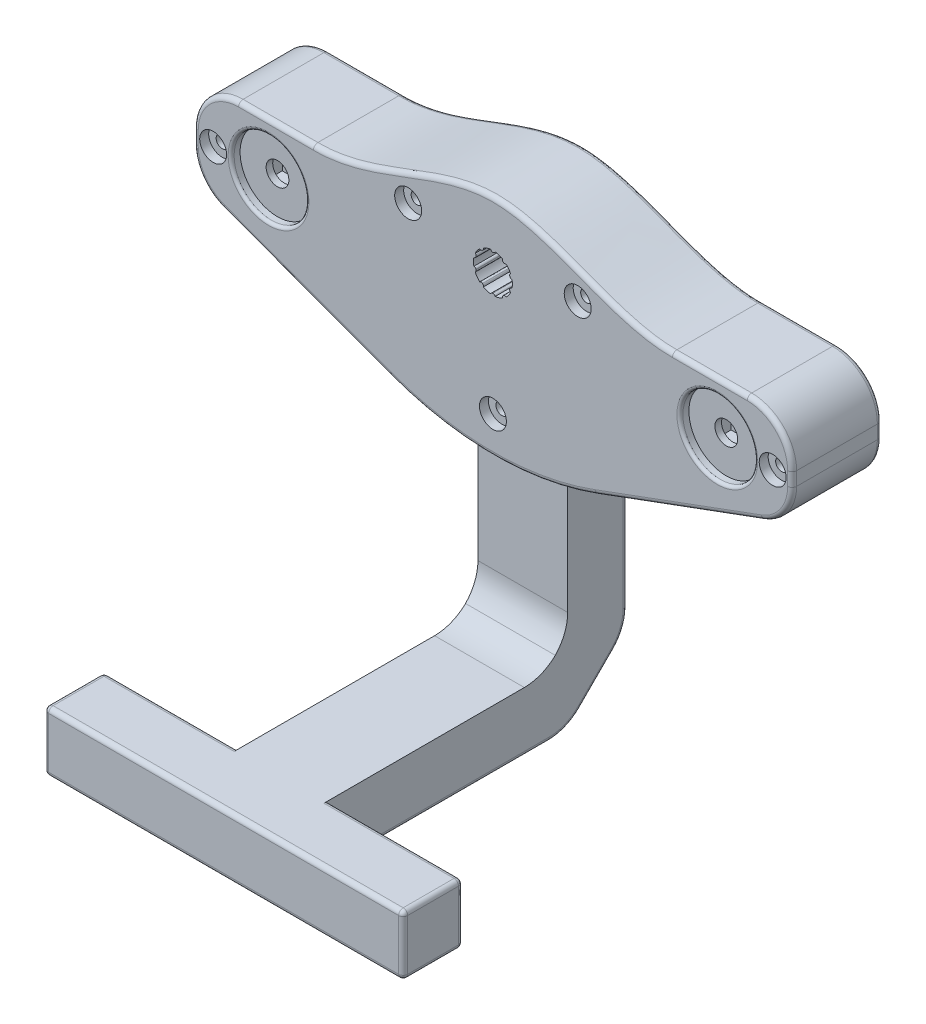
from build123d import *
from OCP.BRepFilletAPI import BRepFilletAPI_MakeChamfer

# Parameters (mm, degrees)
BOSS_EXTRUDE1_DEPTH           = 10
BOSS_EXTRUDE1_DEPTH_BACK      = 20
CUT_EXTRUDE10_START           = -3
SKETCH18_W                    = 25.5
SKETCH18_H                    = 24.1
CUT_EXTRUDE10_DEPTH           = 4.1
SKETCH19_W                    = 8.6
SKETCH19_H                    = 8.6
CUT_EXTRUDE13_DEPTH           = 3.7
CUT_EXTRUDE14_DEPTH           = 2
SKETCH21_R                    = 3.8
CUT_EXTRUDE15_DEPTH           = 116.348128402
SKETCH10_R                    = 12.5
CUT_EXTRUDE8_DEPTH            = 3
SKETCH22_R                    = 0.95
BOSS_EXTRUDE5_DEPTH           = 1.1
BOSS_EXTRUDE5_DRAFT           = 30
BOSS_EXTRUDE5_PROFILE_2_DEPTH = 1.1
BOSS_EXTRUDE5_PROFILE_2_DRAFT = 30
BOSS_EXTRUDE5_PROFILE_3_DEPTH = 1.1
BOSS_EXTRUDE5_PROFILE_3_DRAFT = 30
BOSS_EXTRUDE5_PROFILE_4_DEPTH = 1.1
BOSS_EXTRUDE5_PROFILE_4_DRAFT = 30
CUT_EXTRUDE16_DEPTH           = 8.5
FILLET13_R                    = 2
BOSS_EXTRUDE6_DEPTH           = 3
LPATTERN1_COUNT               = 2
LPATTERN1_PITCH               = 150
LPATTERN1_COPY_1_SKETCH_R     = 0.95
LPATTERN1_COPY_1_DEPTH        = 1.1
LPATTERN1_COPY_1_DRAFT        = 30
LPATTERN1_COPY_2_SKETCH_R     = 0.95
LPATTERN1_COPY_2_DEPTH        = 1.1
LPATTERN1_COPY_2_DRAFT        = 30
LPATTERN1_COPY_3_SKETCH_R     = 0.95
LPATTERN1_COPY_3_DEPTH        = 1.1
LPATTERN1_COPY_3_DRAFT        = 30
LPATTERN1_COPY_4_SKETCH_R     = 0.95
LPATTERN1_COPY_4_DEPTH        = 1.1
LPATTERN1_COPY_4_DRAFT        = 30
LPATTERN1_COPY_5_SKETCH_R     = 0.95
LPATTERN1_COPY_5_DEPTH        = 1.1
LPATTERN1_COPY_5_DRAFT        = 30
LPATTERN1_COPY_6_SKETCH_R     = 0.95
LPATTERN1_COPY_6_DEPTH        = 1.1
LPATTERN1_COPY_6_DRAFT        = 30
LPATTERN1_COPY_7_SKETCH_R     = 0.95
LPATTERN1_COPY_7_DEPTH        = 1.1
LPATTERN1_COPY_7_DRAFT        = 30
FILLET13_OF_LPATTERN1_R       = 2
SKETCH12_R                    = 15
CUT_EXTRUDE9_DEPTH            = 8
SKETCH11_W                    = 30
SKETCH11_H                    = 55.928336779
BOSS_EXTRUDE2_DEPTH           = 20
BOSS_EXTRUDE3_DEPTH           = 15
SKETCH17_W                    = 120
SKETCH17_H                    = 20
BOSS_EXTRUDE4_DEPTH           = 20
CHAMFER1_SIZE                 = 1.5
CHAMFER1_SIZE2                = 0.46241
CHAMFER2_SIZE2                = 5
CHAMFER2_SIZE                 = 8
FILLET11_R                    = 0.78
FILLET1_R                     = 15
FILLET12_R                    = 100
FILLET2_R                     = 1.5
FILLET14_R                    = 1
SKETCH32_R                    = 4.5
CUT_EXTRUDE17_DEPTH           = 3
SKETCH33_R                    = 2
CUT_EXTRUDE18_DEPTH           = 182.793097352
CUT_EXTRUDE19_DEPTH           = 5


# Some blends are built 0.0001 mm under size
with BuildPart() as part:
    # Sketch1 → Boss-Extrude1 (new, two sides: drawn at the far end of the back side and taken through both)
    with BuildSketch(Plane.XY.offset(-BOSS_EXTRUDE1_DEPTH_BACK)):
        with BuildLine():
            Line((-100, -15), (0, -51.866662613))
            Line((0, -51.866662613), (100, -15))
            Line((100, -15), (100, 15))
            Line((100, 15), (60, 15))
            add(Edge.make_bspline(
                [(-60, 15), (-39.699350007, 14.814430853), (0, 45.185569147), (39.699350007, 14.814430853), (60, 15)],
                knots=[0, 0, 0, 0, 0.5, 1, 1, 1, 1], degree=3))
            Line((-60, 15), (-100, 15))
            Line((-100, 15), (-100, -15))
        make_face()
        with BuildLine():
            Line((3.188323159, 2.335673435), (2.875864874, 2.765735369))
            Line((2.875864874, 2.765735369), (4.089390366, 3.647413248))
            Line((4.089390366, 3.647413248), (4.40184865, 3.217351313))
            ThreePointArc((4.40184865, 3.217351313), (5.258610463, 4.17939586), (5.908815238, 5.29151288))
            Line((5.908815238, 5.29151288), (5.403247113, 5.455781921))
            Line((5.403247113, 5.455781921), (5.866772605, 6.882366696))
            Line((5.866772605, 6.882366696), (6.37234073, 6.718097654))
            ThreePointArc((6.37234073, 6.718097654), (6.5, 8), (6.37234073, 9.281902346))
            Line((6.37234073, 9.281902346), (5.866772605, 9.117633304))
            Line((5.866772605, 9.117633304), (5.403247113, 10.544218079))
            Line((5.403247113, 10.544218079), (5.908815238, 10.70848712))
            ThreePointArc((5.908815238, 10.70848712), (5.258610463, 11.82060414), (4.40184865, 12.782648687))
            Line((4.40184865, 12.782648687), (4.089390366, 12.352586752))
            Line((4.089390366, 12.352586752), (2.875864874, 13.234264631))
            Line((2.875864874, 13.234264631), (3.188323159, 13.664326565))
            ThreePointArc((3.188323159, 13.664326565), (2.008610463, 14.181867356), (0.75, 14.456585785))
            Line((0.75, 14.456585785), (0.75, 13.925))
            Line((0.75, 13.925), (-0.75, 13.925))
            Line((-0.75, 13.925), (-0.75, 14.456585785))
            ThreePointArc((-0.75, 14.456585785), (-2.008610463, 14.181867356), (-3.188323159, 13.664326565))
            Line((-3.188323159, 13.664326565), (-2.875864874, 13.234264631))
            Line((-2.875864874, 13.234264631), (-4.089390366, 12.352586752))
            Line((-4.089390366, 12.352586752), (-4.40184865, 12.782648687))
            ThreePointArc((-4.40184865, 12.782648687), (-5.258610463, 11.82060414), (-5.908815238, 10.70848712))
            Line((-5.908815238, 10.70848712), (-5.403247113, 10.544218079))
            Line((-5.403247113, 10.544218079), (-5.866772605, 9.117633304))
            Line((-5.866772605, 9.117633304), (-6.37234073, 9.281902346))
            ThreePointArc((-6.37234073, 9.281902346), (-6.5, 8), (-6.37234073, 6.718097654))
            Line((-6.37234073, 6.718097654), (-5.866772605, 6.882366696))
            Line((-5.866772605, 6.882366696), (-5.403247113, 5.455781921))
            Line((-5.403247113, 5.455781921), (-5.908815238, 5.29151288))
            ThreePointArc((-5.908815238, 5.29151288), (-5.258610463, 4.17939586), (-4.40184865, 3.217351313))
            Line((-4.40184865, 3.217351313), (-4.089390366, 3.647413248))
            Line((-4.089390366, 3.647413248), (-2.875864874, 2.765735369))
            Line((-2.875864874, 2.765735369), (-3.188323159, 2.335673435))
            ThreePointArc((-3.188323159, 2.335673435), (-2.008610463, 1.818132644), (-0.75, 1.543414215))
            Line((-0.75, 1.543414215), (-0.75, 2.075))
            Line((-0.75, 2.075), (0.75, 2.075))
            Line((0.75, 2.075), (0.75, 1.543414215))
            ThreePointArc((0.75, 1.543414215), (2.008610463, 1.818132644), (3.188323159, 2.335673435))
        make_face(mode=Mode.SUBTRACT)
    extrude(amount=BOSS_EXTRUDE1_DEPTH + BOSS_EXTRUDE1_DEPTH_BACK)

    # Sketch18 → Cut-Extrude10 (cut)
    with BuildSketch(Plane.XY.offset(CUT_EXTRUDE10_START)):
        with Locations((-75, 0.285)):
            Rectangle(SKETCH18_W, SKETCH18_H)
    cut_extrude10 = extrude(amount=CUT_EXTRUDE10_DEPTH, mode=Mode.SUBTRACT)

    # Sketch19 → Cut-Extrude13 (cut)
    with BuildSketch(Plane(origin=(0, 0, 1.1), x_dir=(-1, 0, 0), z_dir=(0, 0, -1))):
        with Locations((75, -2.265)):
            Rectangle(SKETCH19_W, SKETCH19_H)
    cut_extrude13 = extrude(amount=-CUT_EXTRUDE13_DEPTH, mode=Mode.SUBTRACT)

    # Sketch20 → Cut-Extrude14 (cut)
    with BuildSketch(Plane(origin=(0, 0, 1.1), x_dir=(-1, 0, 0), z_dir=(0, 0, -1))):
        Polygon((79.3, 2.035), (79.3, 5.335), (81.5, 5.335), (81.5, 9.835), (70.7, 9.835), (70.7, 2.035), align=None)
    cut_extrude14 = extrude(amount=-CUT_EXTRUDE14_DEPTH, mode=Mode.SUBTRACT)

    # Sketch21 → Cut-Extrude15 (cut, through all)
    with BuildSketch(Plane(origin=(0, 0, 4.8), x_dir=(-1, 0, 0), z_dir=(0, 0, -1))):
        with Locations((75, -2.265)):
            Circle(SKETCH21_R)
    cut_extrude15 = extrude(amount=-CUT_EXTRUDE15_DEPTH, mode=Mode.SUBTRACT)

    # Sketch10 → Cut-Extrude8 (cut)
    with BuildSketch(Plane.XY.offset(10)):
        with Locations((-75, -2.265)):
            Circle(SKETCH10_R)
    cut_extrude8 = extrude(amount=-CUT_EXTRUDE8_DEPTH, mode=Mode.SUBTRACT)


with BuildPart() as boss_extrude5_tool:
    # Sketch22 → Boss-Extrude5 (with draft: the straight prism first)
    with BuildSketch(Plane(origin=(0, 0, 1.1), x_dir=(-1, 0, 0), z_dir=(0, 0, -1))):
        with Locations((64.35, 10.235)):
            Circle(SKETCH22_R)
    extrude(amount=BOSS_EXTRUDE5_DEPTH)
    # Boss-Extrude5: the draft: its side faces are tilted about the plane it starts from
    boss_extrude5_sides = [boss_extrude5_tool.faces().sort_by_distance(p)[0] for p in [
        (-63.4, 10.235, 0.55),
    ]]
    draft(boss_extrude5_sides, Plane(origin=(0, 0, 1.1), x_dir=(-1, 0, 0), z_dir=(0, 0, -1)), BOSS_EXTRUDE5_DRAFT)


with BuildPart() as part_1:
    add(part.part)

    # Boss-Extrude5: add boss_extrude5_tool
    add(boss_extrude5_tool.part)


with BuildPart() as boss_extrude5_profile_2_tool:
    # Sketch22 → Boss-Extrude5 profile 2 (with draft: the straight prism first)
    with BuildSketch(Plane(origin=(0, 0, 1.1), x_dir=(-1, 0, 0), z_dir=(0, 0, -1))):
        with Locations((85.65, 10.235)):
            Circle(SKETCH22_R)
    extrude(amount=BOSS_EXTRUDE5_PROFILE_2_DEPTH)
    # Boss-Extrude5 profile 2: the draft: its side faces are tilted about the plane it starts from
    boss_extrude5_profile_2_sides = [boss_extrude5_profile_2_tool.faces().sort_by_distance(p)[0] for p in [
        (-84.7, 10.235, 0.55),
    ]]
    draft(boss_extrude5_profile_2_sides, Plane(origin=(0, 0, 1.1), x_dir=(-1, 0, 0), z_dir=(0, 0, -1)), BOSS_EXTRUDE5_PROFILE_2_DRAFT)


with BuildPart() as part_2:
    add(part_1.part)

    # Boss-Extrude5 profile 2: add boss_extrude5_profile_2_tool
    add(boss_extrude5_profile_2_tool.part)


with BuildPart() as boss_extrude5_profile_3_tool:
    # Sketch22 → Boss-Extrude5 profile 3 (with draft: the straight prism first)
    with BuildSketch(Plane(origin=(0, 0, 1.1), x_dir=(-1, 0, 0), z_dir=(0, 0, -1))):
        with Locations((85.65, -2.105)):
            Circle(SKETCH22_R)
    extrude(amount=BOSS_EXTRUDE5_PROFILE_3_DEPTH)
    # Boss-Extrude5 profile 3: the draft: its side faces are tilted about the plane it starts from
    boss_extrude5_profile_3_sides = [boss_extrude5_profile_3_tool.faces().sort_by_distance(p)[0] for p in [
        (-84.7, -2.105, 0.55),
    ]]
    draft(boss_extrude5_profile_3_sides, Plane(origin=(0, 0, 1.1), x_dir=(-1, 0, 0), z_dir=(0, 0, -1)), BOSS_EXTRUDE5_PROFILE_3_DRAFT)


with BuildPart() as part_3:
    add(part_2.part)

    # Boss-Extrude5 profile 3: add boss_extrude5_profile_3_tool
    add(boss_extrude5_profile_3_tool.part)


with BuildPart() as boss_extrude5_profile_4_tool:
    # Sketch22 → Boss-Extrude5 profile 4 (with draft: the straight prism first)
    with BuildSketch(Plane(origin=(0, 0, 1.1), x_dir=(-1, 0, 0), z_dir=(0, 0, -1))):
        with Locations((64.35, -2.105)):
            Circle(SKETCH22_R)
    extrude(amount=BOSS_EXTRUDE5_PROFILE_4_DEPTH)
    # Boss-Extrude5 profile 4: the draft: its side faces are tilted about the plane it starts from
    boss_extrude5_profile_4_sides = [boss_extrude5_profile_4_tool.faces().sort_by_distance(p)[0] for p in [
        (-63.4, -2.105, 0.55),
    ]]
    draft(boss_extrude5_profile_4_sides, Plane(origin=(0, 0, 1.1), x_dir=(-1, 0, 0), z_dir=(0, 0, -1)), BOSS_EXTRUDE5_PROFILE_4_DRAFT)


with BuildPart() as part_4:
    add(part_3.part)

    # Boss-Extrude5 profile 4: add boss_extrude5_profile_4_tool
    add(boss_extrude5_profile_4_tool.part)

    # Sketch24 → Cut-Extrude16 (cut, symmetric)
    with BuildSketch(Plane(origin=(-75, 0, 0), x_dir=(0, 0, -1), z_dir=(1, 0, 0))):
        Polygon((1.1, -11.765), (1.1, -19.265), (20, -19.265), (20, -18.665), (1.7, -18.665), (1.7, -11.765), align=None)
    cut_extrude16 = extrude(amount=CUT_EXTRUDE16_DEPTH, both=True, mode=Mode.SUBTRACT)

    # Fillet13
    fillet13_edges = [part_4.edges().sort_by_distance(p)[0] for p in [
        (-75, -19.265, -1.1),
        (-75, -18.665, -1.7),
    ]]
    fillet(fillet13_edges, radius=FILLET13_R)

    # Sketch25 → Boss-Extrude6 (add)
    with BuildSketch(Plane.XY.offset(-3)):
        with BuildLine():
            Line((-84.672341587, 10.739166667), (-83.303552478, 10.739166667))
            ThreePointArc((-83.303552478, 10.739166667), (-83.952943725, 8.537943725), (-86.154166667, 7.888552478))
            Line((-86.154166667, 7.888552478), (-86.154166667, 9.257341587))
            ThreePointArc((-86.154166667, 9.257341587), (-84.872182541, 9.457182541), (-84.672341587, 10.739166667))
        make_face()
        with BuildLine():
            Line((-65.327658413, 10.739166667), (-66.696447522, 10.739166667))
            ThreePointArc((-66.696447522, 10.739166667), (-66.047056275, 8.537943725), (-63.845833333, 7.888552478))
            Line((-63.845833333, 7.888552478), (-63.845833333, 9.257341587))
            ThreePointArc((-63.845833333, 9.257341587), (-65.127817459, 9.457182541), (-65.327658413, 10.739166667))
        make_face()
        with BuildLine():
            Line((-85.65, -1.005), (-85.65, 0.295))
            ThreePointArc((-85.65, 0.295), (-83.25, -2.105), (-85.65, -4.505))
            Line((-85.65, -4.505), (-85.65, -3.205))
            ThreePointArc((-85.65, -3.205), (-84.55, -2.105), (-85.65, -1.005))
        make_face()
        with BuildLine():
            Line((-64.35, -3.205), (-64.35, -4.505))
            ThreePointArc((-64.35, -4.505), (-66.75, -2.105), (-64.35, 0.295))
            Line((-64.35, 0.295), (-64.35, -1.005))
            ThreePointArc((-64.35, -1.005), (-65.45, -2.105), (-64.35, -3.205))
        make_face()
    boss_extrude6 = extrude(amount=BOSS_EXTRUDE6_DEPTH)

    # LPattern1: Cut-Extrude10, Cut-Extrude13, Cut-Extrude14, Cut-Extrude15, Cut-Extrude8, Cut-Extrude16, Boss-Extrude6 ×2
    with Locations(*[(i * LPATTERN1_PITCH, 0, 0) for i in range(1, LPATTERN1_COUNT)]):
        add(cut_extrude10, mode=Mode.SUBTRACT)
        add(cut_extrude13, mode=Mode.SUBTRACT)
        add(cut_extrude14, mode=Mode.SUBTRACT)
        add(cut_extrude15, mode=Mode.SUBTRACT)
        add(cut_extrude8, mode=Mode.SUBTRACT)
        add(cut_extrude16, mode=Mode.SUBTRACT)
        add(boss_extrude6)


with BuildPart() as lpattern1_copy_1_tool:
    # LPattern1 copy 1 sketch → LPattern1 copy 1 (with draft: the straight prism first)
    with BuildSketch(Plane(origin=(150, 0, 1.1), x_dir=(-1, 0, 0), z_dir=(0, 0, -1))):
        with Locations((64.35, 10.235)):
            Circle(LPATTERN1_COPY_1_SKETCH_R)
    extrude(amount=LPATTERN1_COPY_1_DEPTH)
    # LPattern1 copy 1: the draft: its side faces are tilted about the plane it starts from
    lpattern1_copy_1_sides = [lpattern1_copy_1_tool.faces().sort_by_distance(p)[0] for p in [
        (86.6, 10.235, 0.55),
    ]]
    draft(lpattern1_copy_1_sides, Plane(origin=(150, 0, 1.1), x_dir=(-1, 0, 0), z_dir=(0, 0, -1)), LPATTERN1_COPY_1_DRAFT)


with BuildPart() as part_5:
    add(part_4.part)

    # LPattern1 copy 1: add lpattern1_copy_1_tool
    add(lpattern1_copy_1_tool.part)


with BuildPart() as lpattern1_copy_2_tool:
    # LPattern1 copy 2 sketch → LPattern1 copy 2 (with draft: the straight prism first)
    with BuildSketch(Plane(origin=(150, 0, 1.1), x_dir=(-1, 0, 0), z_dir=(0, 0, -1))):
        with Locations((85.65, 10.235)):
            Circle(LPATTERN1_COPY_2_SKETCH_R)
    extrude(amount=LPATTERN1_COPY_2_DEPTH)
    # LPattern1 copy 2: the draft: its side faces are tilted about the plane it starts from
    lpattern1_copy_2_sides = [lpattern1_copy_2_tool.faces().sort_by_distance(p)[0] for p in [
        (65.3, 10.235, 0.55),
    ]]
    draft(lpattern1_copy_2_sides, Plane(origin=(150, 0, 1.1), x_dir=(-1, 0, 0), z_dir=(0, 0, -1)), LPATTERN1_COPY_2_DRAFT)


with BuildPart() as part_6:
    add(part_5.part)

    # LPattern1 copy 2: add lpattern1_copy_2_tool
    add(lpattern1_copy_2_tool.part)


with BuildPart() as lpattern1_copy_3_tool:
    # LPattern1 copy 3 sketch → LPattern1 copy 3 (with draft: the straight prism first)
    with BuildSketch(Plane(origin=(150, 0, 1.1), x_dir=(-1, 0, 0), z_dir=(0, 0, -1))):
        with Locations((85.65, -2.105)):
            Circle(LPATTERN1_COPY_3_SKETCH_R)
    extrude(amount=LPATTERN1_COPY_3_DEPTH)
    # LPattern1 copy 3: the draft: its side faces are tilted about the plane it starts from
    lpattern1_copy_3_sides = [lpattern1_copy_3_tool.faces().sort_by_distance(p)[0] for p in [
        (65.3, -2.105, 0.55),
    ]]
    draft(lpattern1_copy_3_sides, Plane(origin=(150, 0, 1.1), x_dir=(-1, 0, 0), z_dir=(0, 0, -1)), LPATTERN1_COPY_3_DRAFT)


with BuildPart() as part_7:
    add(part_6.part)

    # LPattern1 copy 3: add lpattern1_copy_3_tool
    add(lpattern1_copy_3_tool.part)


with BuildPart() as lpattern1_copy_4_tool:
    # LPattern1 copy 4 sketch → LPattern1 copy 4 (with draft: the straight prism first)
    with BuildSketch(Plane(origin=(150, 0, 1.1), x_dir=(-1, 0, 0), z_dir=(0, 0, -1))):
        with Locations((64.35, -2.105)):
            Circle(LPATTERN1_COPY_4_SKETCH_R)
    extrude(amount=LPATTERN1_COPY_4_DEPTH)
    # LPattern1 copy 4: the draft: its side faces are tilted about the plane it starts from
    lpattern1_copy_4_sides = [lpattern1_copy_4_tool.faces().sort_by_distance(p)[0] for p in [
        (86.6, -2.105, 0.55),
    ]]
    draft(lpattern1_copy_4_sides, Plane(origin=(150, 0, 1.1), x_dir=(-1, 0, 0), z_dir=(0, 0, -1)), LPATTERN1_COPY_4_DRAFT)


with BuildPart() as part_8:
    add(part_7.part)

    # LPattern1 copy 4: add lpattern1_copy_4_tool
    add(lpattern1_copy_4_tool.part)


with BuildPart() as lpattern1_copy_5_tool:
    # LPattern1 copy 5 sketch → LPattern1 copy 5 (with draft: the straight prism first)
    with BuildSketch(Plane(origin=(150, 0, 1.1), x_dir=(-1, 0, 0), z_dir=(0, 0, -1))):
        with Locations((85.65, 10.235)):
            Circle(LPATTERN1_COPY_5_SKETCH_R)
    extrude(amount=LPATTERN1_COPY_5_DEPTH)
    # LPattern1 copy 5: the draft: its side faces are tilted about the plane it starts from
    lpattern1_copy_5_sides = [lpattern1_copy_5_tool.faces().sort_by_distance(p)[0] for p in [
        (65.3, 10.235, 0.55),
    ]]
    draft(lpattern1_copy_5_sides, Plane(origin=(150, 0, 1.1), x_dir=(-1, 0, 0), z_dir=(0, 0, -1)), LPATTERN1_COPY_5_DRAFT)


with BuildPart() as part_9:
    add(part_8.part)

    # LPattern1 copy 5: add lpattern1_copy_5_tool
    add(lpattern1_copy_5_tool.part)


with BuildPart() as lpattern1_copy_6_tool:
    # LPattern1 copy 6 sketch → LPattern1 copy 6 (with draft: the straight prism first)
    with BuildSketch(Plane(origin=(150, 0, 1.1), x_dir=(-1, 0, 0), z_dir=(0, 0, -1))):
        with Locations((85.65, -2.105)):
            Circle(LPATTERN1_COPY_6_SKETCH_R)
    extrude(amount=LPATTERN1_COPY_6_DEPTH)
    # LPattern1 copy 6: the draft: its side faces are tilted about the plane it starts from
    lpattern1_copy_6_sides = [lpattern1_copy_6_tool.faces().sort_by_distance(p)[0] for p in [
        (65.3, -2.105, 0.55),
    ]]
    draft(lpattern1_copy_6_sides, Plane(origin=(150, 0, 1.1), x_dir=(-1, 0, 0), z_dir=(0, 0, -1)), LPATTERN1_COPY_6_DRAFT)


with BuildPart() as part_10:
    add(part_9.part)

    # LPattern1 copy 6: add lpattern1_copy_6_tool
    add(lpattern1_copy_6_tool.part)


with BuildPart() as lpattern1_copy_7_tool:
    # LPattern1 copy 7 sketch → LPattern1 copy 7 (with draft: the straight prism first)
    with BuildSketch(Plane(origin=(150, 0, 1.1), x_dir=(-1, 0, 0), z_dir=(0, 0, -1))):
        with Locations((64.35, -2.105)):
            Circle(LPATTERN1_COPY_7_SKETCH_R)
    extrude(amount=LPATTERN1_COPY_7_DEPTH)
    # LPattern1 copy 7: the draft: its side faces are tilted about the plane it starts from
    lpattern1_copy_7_sides = [lpattern1_copy_7_tool.faces().sort_by_distance(p)[0] for p in [
        (86.6, -2.105, 0.55),
    ]]
    draft(lpattern1_copy_7_sides, Plane(origin=(150, 0, 1.1), x_dir=(-1, 0, 0), z_dir=(0, 0, -1)), LPATTERN1_COPY_7_DRAFT)


with BuildPart() as part_11:
    add(part_10.part)

    # LPattern1 copy 7: add lpattern1_copy_7_tool
    add(lpattern1_copy_7_tool.part)

    # Fillet13 of LPattern1
    fillet13_of_lpattern1_edges = [part_11.edges().sort_by_distance(p)[0] for p in [
        (75, -19.265, -1.1),
        (75, -18.665, -1.7),
    ]]
    fillet(fillet13_of_lpattern1_edges, radius=FILLET13_OF_LPATTERN1_R)

    # Sketch12 → Cut-Extrude9 (cut)
    with BuildSketch(Plane(origin=(0, 0, -20), x_dir=(-1, 0, 0), z_dir=(0, 0, -1))):
        with Locations((0, 8)):
            Circle(SKETCH12_R)
    extrude(amount=-CUT_EXTRUDE9_DEPTH, mode=Mode.SUBTRACT)

    # Sketch11 → Boss-Extrude2 (add)
    with BuildSketch(Plane.XY):
        with Locations((0, -74.30083161)):
            Rectangle(SKETCH11_W, SKETCH11_H)
    extrude(amount=-BOSS_EXTRUDE2_DEPTH)

    # Sketch16 → Boss-Extrude3 (add, symmetric)
    with BuildSketch(Plane(origin=(0, 0, 0), x_dir=(0, 0, -1), z_dir=(1, 0, 0))):
        Polygon((20, -102.265), (0, -122.265), (-100, -122.265), (-100, -102.265), (-8.284271247, -102.265), (0, -93.980728753), align=None)
    extrude(amount=BOSS_EXTRUDE3_DEPTH, both=True)

    # Sketch17 → Boss-Extrude4 (add)
    with BuildSketch(Plane.XZ.offset(122.265)):
        with Locations((0, 90)):
            Rectangle(SKETCH17_W, SKETCH17_H)
    extrude(amount=-BOSS_EXTRUDE4_DEPTH)

    # Chamfer1: one chamfer whose edges measure the first distance from different faces: ONE call of the kernel's chamfer builder (chamfer() names one face for all edges)
    chamfer1_edges_1 = [part_11.edges().sort_by_distance(p)[0] for p in [
        (0, 2.075, -12),
    ]]
    chamfer1_side_1 = [part_11.faces().sort_by_distance(p)[0] for p in [
        (0, 2.075, -1),
    ]]
    chamfer1_edges_2 = [part_11.edges().sort_by_distance(p)[0] for p in [
        (3.48262762, 3.206574308, -12),
    ]]
    chamfer1_side_2 = [part_11.faces().sort_by_distance(p)[0] for p in [
        (3.48262762, 3.206574308, -1),
    ]]
    chamfer1_edges_3 = [part_11.edges().sort_by_distance(p)[0] for p in [
        (5.635009859, 6.169074308, -12),
    ]]
    chamfer1_side_3 = [part_11.faces().sort_by_distance(p)[0] for p in [
        (5.635009859, 6.169074308, -1),
    ]]
    chamfer1_edges_4 = [part_11.edges().sort_by_distance(p)[0] for p in [
        (5.635009859, 9.830925692, -12),
    ]]
    chamfer1_side_4 = [part_11.faces().sort_by_distance(p)[0] for p in [
        (5.635009859, 9.830925692, -1),
    ]]
    chamfer1_edges_5 = [part_11.edges().sort_by_distance(p)[0] for p in [
        (3.48262762, 12.793425692, -12),
    ]]
    chamfer1_side_5 = [part_11.faces().sort_by_distance(p)[0] for p in [
        (3.48262762, 12.793425692, -1),
    ]]
    chamfer1_edges_6 = [part_11.edges().sort_by_distance(p)[0] for p in [
        (0, 13.925, -12),
    ]]
    chamfer1_side_6 = [part_11.faces().sort_by_distance(p)[0] for p in [
        (0, 13.925, -1),
    ]]
    chamfer1_edges_7 = [part_11.edges().sort_by_distance(p)[0] for p in [
        (-3.48262762, 12.793425692, -12),
    ]]
    chamfer1_side_7 = [part_11.faces().sort_by_distance(p)[0] for p in [
        (-3.48262762, 12.793425692, -1),
    ]]
    chamfer1_edges_8 = [part_11.edges().sort_by_distance(p)[0] for p in [
        (-5.635009859, 9.830925692, -12),
    ]]
    chamfer1_side_8 = [part_11.faces().sort_by_distance(p)[0] for p in [
        (-5.635009859, 9.830925692, -1),
    ]]
    chamfer1_edges_9 = [part_11.edges().sort_by_distance(p)[0] for p in [
        (-5.635009859, 6.169074308, -12),
    ]]
    chamfer1_side_9 = [part_11.faces().sort_by_distance(p)[0] for p in [
        (-5.635009859, 6.169074308, -1),
    ]]
    chamfer1_edges_10 = [part_11.edges().sort_by_distance(p)[0] for p in [
        (-3.48262762, 3.206574308, -12),
    ]]
    chamfer1_side_10 = [part_11.faces().sort_by_distance(p)[0] for p in [
        (-3.48262762, 3.206574308, -1),
    ]]
    chamfer1 = BRepFilletAPI_MakeChamfer(part_11.part.solid().wrapped)
    for e in chamfer1_edges_1:
        chamfer1.Add(CHAMFER1_SIZE, CHAMFER1_SIZE2, e.wrapped, chamfer1_side_1[0].wrapped)  # the first distance lies on this face
    for e in chamfer1_edges_2:
        chamfer1.Add(CHAMFER1_SIZE, CHAMFER1_SIZE2, e.wrapped, chamfer1_side_2[0].wrapped)  # the first distance lies on this face
    for e in chamfer1_edges_3:
        chamfer1.Add(CHAMFER1_SIZE, CHAMFER1_SIZE2, e.wrapped, chamfer1_side_3[0].wrapped)  # the first distance lies on this face
    for e in chamfer1_edges_4:
        chamfer1.Add(CHAMFER1_SIZE, CHAMFER1_SIZE2, e.wrapped, chamfer1_side_4[0].wrapped)  # the first distance lies on this face
    for e in chamfer1_edges_5:
        chamfer1.Add(CHAMFER1_SIZE, CHAMFER1_SIZE2, e.wrapped, chamfer1_side_5[0].wrapped)  # the first distance lies on this face
    for e in chamfer1_edges_6:
        chamfer1.Add(CHAMFER1_SIZE, CHAMFER1_SIZE2, e.wrapped, chamfer1_side_6[0].wrapped)  # the first distance lies on this face
    for e in chamfer1_edges_7:
        chamfer1.Add(CHAMFER1_SIZE, CHAMFER1_SIZE2, e.wrapped, chamfer1_side_7[0].wrapped)  # the first distance lies on this face
    for e in chamfer1_edges_8:
        chamfer1.Add(CHAMFER1_SIZE, CHAMFER1_SIZE2, e.wrapped, chamfer1_side_8[0].wrapped)  # the first distance lies on this face
    for e in chamfer1_edges_9:
        chamfer1.Add(CHAMFER1_SIZE, CHAMFER1_SIZE2, e.wrapped, chamfer1_side_9[0].wrapped)  # the first distance lies on this face
    for e in chamfer1_edges_10:
        chamfer1.Add(CHAMFER1_SIZE, CHAMFER1_SIZE2, e.wrapped, chamfer1_side_10[0].wrapped)  # the first distance lies on this face
    add(Compound.cast(chamfer1.Shape()), mode=Mode.REPLACE)

    # Chamfer2
    chamfer2_edges = [part_11.edges().sort_by_distance(p)[0] for p in [
        (15, 8, -20),
    ]]
    chamfer2_side = [part_11.faces().sort_by_distance(p)[0] for p in [
        (15, 8, -19.9),
    ]]
    chamfer(chamfer2_edges, length=CHAMFER2_SIZE - 0.0001, length2=CHAMFER2_SIZE2 - 0.0001, reference=chamfer2_side[0])  # a hair under: the kernel refuses the full size

    # Fillet11
    # the kernel refuses this fillet: 0.78 mm, written as the material it takes off along each edge
    with BuildSketch(Plane(origin=(-4.089390366, 12.352586752, -12.348462837), x_dir=(-0.5877852522924715, 0.8090169943749486, 0), z_dir=(0, 0, 1)), Plane(origin=(-5.866772605, 9.117633304, -12.348462837), x_dir=(-0.9510565162951549, 0.3090169943749433, 0), z_dir=(0, 0, 1)), Plane(origin=(-0.75, 13.925, -12.348462837), x_dir=(0, 1, 0), z_dir=(0, 0, 1)), Plane(origin=(2.875864874, 13.234264631, -12.348462837), x_dir=(0.587785252292472, 0.8090169943749482, 0), z_dir=(0, 0, 1)), Plane(origin=(5.403247113, 10.544218079, -12.348462837), x_dir=(0.9510565162951538, 0.30901699437494734, 0), z_dir=(0, 0, 1)), Plane(origin=(5.866772605, 6.882366696, -12.348462837), x_dir=(0.9510565162951544, -0.30901699437494534, 0), z_dir=(0, 0, 1)), Plane(origin=(-5.403247113, 5.455781921, -12.348462837), x_dir=(-0.9510565162951544, -0.30901699437494484, 0), z_dir=(0, 0, 1)), Plane(origin=(-2.875864874, 2.765735369, -12.348462837), x_dir=(-0.5877852522924728, -0.8090169943749477, 0), z_dir=(0, 0, 1)), Plane(origin=(0.75, 2.075, -12.348462837), x_dir=(0, -1, 0), z_dir=(0, 0, 1)), Plane(origin=(4.089390366, 3.647413248, -12.348462837), x_dir=(0.5877852522924725, -0.8090169943749479, 0), z_dir=(0, 0, 1))) as fillet11_piece_1:
        with BuildLine():
            CenterArc((0.78, -0.739385135), FILLET11_R, 108.571012268, 71.428987732)
            Line((0, -0.739385135), (-0.0156, -0.739385135))
            Line((-0.0156, -0.739385135), (-0.0156, 0))
            Line((-0.0156, 0), (0, 0.0156))
            ThreePointArc((0, 0.0156), (0.265792893, 0.0156), (0.526617501, 0.014787703))
            Line((0.526617501, 0.014787703), (0.531585785, 0))
        make_face()
    extrude(amount=24.196925675, mode=Mode.SUBTRACT)
    with BuildSketch(Plane(origin=(-5.403247113, 10.544218079, -12.348462837), x_dir=(-0.9510565162951551, 0.30901699437494284, 0), z_dir=(0, 0, 1)), Plane(origin=(-2.875864874, 13.234264631, -12.348462837), x_dir=(-0.5877852522924741, 0.8090169943749466, 0), z_dir=(0, 0, 1)), Plane(origin=(0.75, 13.925, -12.348462837), x_dir=(0, 1, 0), z_dir=(0, 0, 1)), Plane(origin=(4.089390366, 12.352586752, -12.348462837), x_dir=(0.587785252292471, 0.8090169943749491, 0), z_dir=(0, 0, 1)), Plane(origin=(5.866772605, 9.117633304, -12.348462837), x_dir=(0.9510565162951528, 0.30901699437494984, 0), z_dir=(0, 0, 1)), Plane(origin=(5.403247113, 5.455781921, -12.348462837), x_dir=(0.9510565162951544, -0.30901699437494534, 0), z_dir=(0, 0, 1)), Plane(origin=(-5.866772605, 6.882366696, -12.348462837), x_dir=(-0.9510565162951548, -0.30901699437494434, 0), z_dir=(0, 0, 1)), Plane(origin=(-4.089390366, 3.647413248, -12.348462837), x_dir=(-0.5877852522924712, -0.8090169943749487, 0), z_dir=(0, 0, 1)), Plane(origin=(-0.75, 2.075, -12.348462837), x_dir=(0, -1, 0), z_dir=(0, 0, 1)), Plane(origin=(2.875864874, 2.765735369, -12.348462837), x_dir=(0.5877852522924736, -0.8090169943749472, 0), z_dir=(0, 0, 1))) as fillet11_piece_2:
        with BuildLine():
            CenterArc((0.78, 0.739385135), FILLET11_R, 180, 71.428987732)
            Line((0, 0.739385135), (-0.0156, 0.739385135))
            Line((-0.0156, 0.739385135), (-0.0156, 0))
            Line((-0.0156, 0), (0, -0.0156))
            ThreePointArc((0, -0.0156), (0.265792893, -0.0156), (0.526617501, -0.014787703))
            Line((0.526617501, -0.014787703), (0.531585785, 0))
        make_face()
    extrude(amount=24.196925675, mode=Mode.SUBTRACT)

    # Fillet1
    # the kernel refuses this fillet: 15 mm, written as the material it adds along each edge
    with BuildSketch(Plane(origin=(-15, -102.265, 8.284271247), x_dir=(0, 0.7071067811865517, -0.7071067811865434), z_dir=(1, 0, 0)), Plane(origin=(-15, -93.980728753, 0), x_dir=(0, 1, 0), z_dir=(1, 0, 0))) as fillet1_piece_1:
        with BuildLine():
            CenterArc((FILLET1_R * 0.414213562373, FILLET1_R), FILLET1_R, 225, 45)
            Line((-FILLET1_R * 0.292893218813, FILLET1_R * 0.292893218813), (0, 0))
            Line((0, 0), (FILLET1_R * 0.414213562373, 0))
        make_face()
    extrude(amount=30)
    # the kernel refuses this fillet: 15 mm, written as the material it takes off along each edge
    with BuildSketch(Plane(origin=(100, -15, -46.142245395), x_dir=(-0.9382683508839744, -0.34590822732260523, 0), z_dir=(0, 0, 1))) as fillet1_2_piece_1:
        with BuildLine():
            CenterArc((FILLET1_R * 0.697126543873, -FILLET1_R), FILLET1_R, 90, 69.762752806)
            Line((-FILLET1_R * 0.241141807011, -FILLET1_R * 0.654091772677), (0, 0))
            Line((0, 0), (FILLET1_R * 0.697126543873, 0))
        make_face()
    extrude(amount=82.28449079, mode=Mode.SUBTRACT)
    with BuildSketch(Plane(origin=(-100, -15, 36.142245395), x_dir=(0, 1, 0), z_dir=(0, 0, -1))) as fillet1_2_piece_2:
        with BuildLine():
            CenterArc((FILLET1_R * 0.697126543873, FILLET1_R), FILLET1_R, 200.237247194, 69.762752806)
            Line((-FILLET1_R * 0.241141807011, FILLET1_R * 0.654091772677), (0, 0))
            Line((0, 0), (FILLET1_R * 0.697126543873, 0))
        make_face()
    extrude(amount=82.28449079, mode=Mode.SUBTRACT)
    with BuildSketch(Plane(origin=(30.533008589, -122.265, 0), x_dir=(0, 0.7071067811865513, -0.7071067811865437), z_dir=(-1, 0, 0))) as fillet1_2_piece_3:
        with BuildLine():
            CenterArc((FILLET1_R * 0.414213562373, -FILLET1_R), FILLET1_R, 90, 45)
            Line((-FILLET1_R * 0.292893218813, -FILLET1_R * 0.292893218813), (0, 0))
            Line((0, 0), (FILLET1_R * 0.414213562373, 0))
        make_face()
    extrude(amount=61.066017178, mode=Mode.SUBTRACT)
    with BuildSketch(Plane(origin=(-30.533008589, -102.265, -20), x_dir=(0, 1, 0), z_dir=(1, 0, 0))) as fillet1_2_piece_4:
        with BuildLine():
            CenterArc((FILLET1_R * 0.414213562373, FILLET1_R), FILLET1_R, 225, 45)
            Line((-FILLET1_R * 0.292893218813, FILLET1_R * 0.292893218813), (0, 0))
            Line((0, 0), (FILLET1_R * 0.414213562373, 0))
        make_face()
    extrude(amount=61.066017178, mode=Mode.SUBTRACT)
    with BuildSketch(Plane(origin=(100, 15, -57.5), x_dir=(0, -1, 0), z_dir=(0, 0, 1)), Plane(origin=(-100, 15, 47.5), x_dir=(0, -1, 0), z_dir=(0, 0, -1))) as fillet1_2_piece_5:
        with BuildLine():
            CenterArc((FILLET1_R, -FILLET1_R), FILLET1_R, 90, 90)
            Line((0, -FILLET1_R), (0, 0))
            Line((0, 0), (FILLET1_R, 0))
        make_face()
    extrude(amount=105, mode=Mode.SUBTRACT)

    # Fillet12
    # the kernel refuses this fillet: 100 mm, written as the material it takes off along each edge
    with BuildSketch(Plane(origin=(0, -51.866662613, -92.166656532), x_dir=(-0.9382683508839743, 0.34590822732260545, 0), z_dir=(0, 0, 1))) as fillet12_piece_1_section:
        with BuildLine():
            CenterArc((FILLET12_R * 0.368666626127, -FILLET12_R), FILLET12_R, 90, 40.474494387)
            Line((-FILLET12_R * 0.280442857887, -FILLET12_R * 0.239305003459), (0, 0))
            Line((0, 0), (FILLET12_R * 0.368666626127, 0))
        make_face()
    fillet12_piece_1 = extrude(amount=194.333313064, mode=Mode.PRIVATE)
    fillet12_piece_1 = split(fillet12_piece_1, bisect_by=Plane(origin=(-15, -43.857999978, -10), z_dir=(-1, 0, 0)), keep=Keep.TOP, mode=Mode.PRIVATE)
    add(fillet12_piece_1, mode=Mode.SUBTRACT)
    with BuildSketch(Plane(origin=(0, -51.866662613, -92.166656532), x_dir=(-0.9382683508839743, 0.34590822732260545, 0), z_dir=(0, 0, 1))) as fillet12_piece_2_section:
        with BuildLine():
            CenterArc((FILLET12_R * 0.368666626127, -FILLET12_R), FILLET12_R, 90, 40.474494387)
            Line((-FILLET12_R * 0.280442857887, -FILLET12_R * 0.239305003459), (0, 0))
            Line((0, 0), (FILLET12_R * 0.368666626127, 0))
        make_face()
    fillet12_piece_2 = extrude(amount=194.333313064, mode=Mode.PRIVATE)
    fillet12_piece_2 = split(fillet12_piece_2, bisect_by=Plane(origin=(15, -43.857999978, -10), z_dir=(1, 0, 0)), keep=Keep.TOP, mode=Mode.PRIVATE)
    add(fillet12_piece_2, mode=Mode.SUBTRACT)
    with BuildSketch(Plane(origin=(0, -51.866662613, 0), x_dir=(-0.9382683508839743, 0.34590822732260545, 0), z_dir=(0, 0, 1))) as fillet12_piece_3:
        with BuildLine():
            CenterArc((FILLET12_R * 0.368666626127, -FILLET12_R), FILLET12_R, 90, 40.474494387)
            Line((-FILLET12_R * 0.280442857887, -FILLET12_R * 0.239305003459), (0, 0))
            Line((0, 0), (FILLET12_R * 0.368666626127, 0))
        make_face()
    extrude(amount=102.166656532, mode=Mode.SUBTRACT)

    # Fillet2
    fillet2_edges = [part_11.edges().sort_by_distance(p)[0] for p in [
        (-72.5, 15, 10),
        (-72.5, 15, -20),
        (-15, -70.103870922, -20),
        (0, -102.265, 100),
        (0, -122.265, 100),
        (-15, -122.265, 43.106601718),
        (15, -122.265, 43.106601718),
        (37.5, -122.265, 80),
        (60, -122.265, 90),
        (37.5, -102.265, 80),
        (60, -112.265, 80),
        (-60, -102.265, 90),
        (-60, -112.265, 80),
        (-60, -112.265, 100),
        (60, -102.265, 90),
        (60, -112.265, 100),
        (-37.5, -102.265, 80),
        (-37.5, -122.265, 80),
        (-60, -122.265, 90),
        (100, -2.271550921, 10),
        (100, -2.271550921, -20),
        (72.5, 15, 10),
        (-100, -2.271550921, 10),
        (-62.389723071, -28.865653903, 10),
        (-97.305067069, -13.12129072, 10),
        (97.305067069, -13.12129072, 10),
        (-95.606601718, 10.606601718, 10),
        (95.606601718, 10.606601718, 10),
        (72.5, 15, -20),
        (15, -70.103870922, -20),
        (-62.389723071, -28.865653903, -20),
        (-100, -2.271550921, -20),
        (-97.305067069, -13.12129072, -20),
        (97.305067069, -13.12129072, -20),
        (-95.606601718, 10.606601718, -20),
        (95.606601718, 10.606601718, -20),
        (-15, -112.265, -10),
        (15, -112.265, -10),
        (-15, -101.79204805, -18.858192988),
        (-15, -121.123192988, 0.47295195),
        (15, -101.79204805, -18.858192988),
        (15, -121.123192988, 0.47295195),
        (62.389723071, -28.865653903, 10),
        (0, -45.287345613, 10),
        (62.389723071, -28.865653903, -20),
        (-24.923227566, -42.131719366, -20),
        (15, -44.155945279, -10),
        (-15, -44.155945279, -10),
    ]]
    fillet(fillet2_edges, radius=FILLET2_R)

    # Fillet14
    fillet14_edges = [part_11.edges().sort_by_distance(p)[0] for p in [
        (-87.5, -2.265, 10),
        (62.5, -2.265, 10),
        (19.9999, 8, -20),
    ]]
    fillet(fillet14_edges, radius=FILLET14_R)

    # Sketch32 → Cut-Extrude17 (cut)
    with BuildSketch(Plane.XY.offset(10)):
        with Locations((-93.5, -2.271550921)):
            Circle(SKETCH32_R)
        with Locations((-28.332209431, 14.008347309)):
            Circle(SKETCH32_R)
        with Locations((0, -32.79283808)):
            Circle(SKETCH32_R)
        with Locations(Location((28.332209431, 14.008347309, 0), (0, 0, 180))):
            Circle(SKETCH32_R)
        with Locations(Location((93.5, -2.271550921, 0), (0, 0, 180))):
            Circle(SKETCH32_R)
    extrude(amount=-CUT_EXTRUDE17_DEPTH, mode=Mode.SUBTRACT)

    # Sketch33 → Cut-Extrude18 (cut, through all)
    with BuildSketch(Plane.XY.offset(10)):
        with Locations((-28.332209431, 14.008347309)):
            Circle(SKETCH33_R)
        with Locations((-93.5, -2.271550921)):
            Circle(SKETCH33_R)
        with Locations((0, -32.79283808)):
            Circle(SKETCH33_R)
        with Locations(Location((28.332209431, 14.008347309, 0), (0, 0, 180))):
            Circle(SKETCH33_R)
        with Locations(Location((93.5, -2.271550921, 0), (0, 0, 180))):
            Circle(SKETCH33_R)
    extrude(amount=-CUT_EXTRUDE18_DEPTH, mode=Mode.SUBTRACT)

    # Sketch35 → Cut-Extrude19 (cut)
    with BuildSketch(Plane(origin=(0, 0, -20), x_dir=(-1, 0, 0), z_dir=(0, 0, -1))):
        Polygon((-98.05, 0.355392804), (-98.05, -4.898494646), (-93.5, -7.525438371), (-88.95, -4.898494646), (-88.95, 0.355392804), (-93.5, 2.982336529), align=None)
        Polygon((4.55, -30.165894355), (0, -27.53895063), (-4.55, -30.165894355), (-4.55, -35.419781805), (0, -38.04672553), (4.55, -35.419781805), align=None)
        Polygon((-23.782209431, 16.635291034), (-28.332209431, 19.262234759), (-32.882209431, 16.635291034), (-32.882209431, 11.381403584), (-28.332209431, 8.75445986), (-23.782209431, 11.381403584), align=None)
        Polygon((32.882209431, 16.635291034), (28.332209431, 19.262234759), (23.782209431, 16.635291034), (23.782209431, 11.381403584), (28.332209431, 8.75445986), (32.882209431, 11.381403584), align=None)
        Polygon((98.05, 0.355392804), (93.5, 2.982336529), (88.95, 0.355392804), (88.95, -4.898494646), (93.5, -7.525438371), (98.05, -4.898494646), align=None)
    extrude(amount=-CUT_EXTRUDE19_DEPTH, mode=Mode.SUBTRACT)


solid = part_11.part
